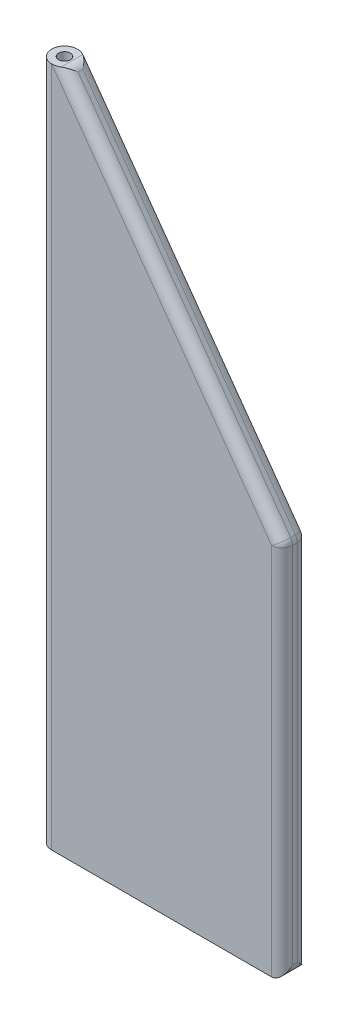
from build123d import *

# Parameters (mm, degrees)
SKETCH1_R                       = 1.225
SKETCH1_R_2                     = 0.56
BOSS_EXTRUDE1_DEPTH             = 65
BOSS_EXTRUDE2_DEPTH             = 36
BOSS_EXTRUDE3_REACH             = 70.633
BOSS_EXTRUDE3_DIRECTION_2_REACH = 70.633
CUT_EXTRUDE1_DEPTH              = 69.633086955
CUT_EXTRUDE1_DEPTH_BACK         = 69.633086955
SKETCH3_R                       = 0.56
FILLET2_R                       = 1


with BuildPart() as part:
    # Sketch1 → Boss-Extrude1 (new body)
    with BuildSketch(Plane(origin=(0, 0, 0), x_dir=(1, 0, 0), z_dir=(0, 1, 0))):
        with Locations(Location((0, 0, 0), (0, 0, 270))):
            Circle(SKETCH1_R)
        with Locations(Location((0, 0, 0), (0, 0, 270))):
            Circle(SKETCH1_R_2, mode=Mode.SUBTRACT)
    extrude(amount=BOSS_EXTRUDE1_DEPTH)

    # Sketch1<4> → Boss-Extrude2 (add)
    with BuildSketch(Plane(origin=(0, 0, 0), x_dir=(1, 0, 0), z_dir=(0, 1, 0))):
        with BuildLine():
            Line((22, 1.225), (0, 1.225))
            ThreePointArc((0, 1.225), (0.866205807, 0.866205807), (1.225, 0))
            ThreePointArc((1.225, 0), (0.866205807, -0.866205807), (0, -1.225))
            Line((0, -1.225), (22, -1.225))
            Line((22, -1.225), (22, 1.225))
        make_face()
    extrude(amount=BOSS_EXTRUDE2_DEPTH)

    # Boss-Extrude3: up to this face of the body (flat: up to its plane)
    boss_extrude3_end = Plane(part.part.faces().sort_by_distance((11, 18, 1.225))[0])
    # Sketch2 → Boss-Extrude3 (add, up to the picked face)
    with BuildSketch(Plane.XY, mode=Mode.PRIVATE) as boss_extrude3_sk1:
        Polygon((1.225, 65), (22, 36), (0, 36), (0, 65), align=None)
    boss_extrude3_tool1 = split(extrude(boss_extrude3_sk1.sketch, amount=BOSS_EXTRUDE3_REACH, mode=Mode.PRIVATE), bisect_by=boss_extrude3_end, keep=Keep.BOTH, mode=Mode.PRIVATE)
    add(boss_extrude3_tool1.solids().sort_by(Axis((7.354871, 46.176534, 0), (0, 0, 1)))[0])

    # Boss-Extrude3 direction 2: up to this face of the body (flat: up to its plane)
    boss_extrude3_direction_2_end = Plane(part.part.faces().sort_by_distance((11, 18, -1.225))[0])
    # Sketch2 → Boss-Extrude3 direction 2 (add, up to the picked face)
    with BuildSketch(Plane.XY, mode=Mode.PRIVATE) as boss_extrude3_direction_2_sk1:
        Polygon((1.225, 65), (22, 36), (0, 36), (0, 65), align=None)
    boss_extrude3_direction_2_tool1 = split(extrude(boss_extrude3_direction_2_sk1.sketch, amount=-BOSS_EXTRUDE3_DIRECTION_2_REACH, mode=Mode.PRIVATE), bisect_by=boss_extrude3_direction_2_end, keep=Keep.BOTH, mode=Mode.PRIVATE)
    add(boss_extrude3_direction_2_tool1.solids().sort_by(Axis((7.354871, 46.176534, 0), (0, 0, -1)))[0])

    # Sketch3 → Cut-Extrude1 (cut, two sides: drawn at the far end of the back side and taken through both)
    with BuildSketch(Plane(origin=(0, 0, 0), x_dir=(1, 0, 0), z_dir=(0, 1, 0)).offset(-CUT_EXTRUDE1_DEPTH_BACK)):
        with Locations(Location((0, 0, 0), (0, 0, 270))):
            Circle(SKETCH3_R)
    extrude(amount=CUT_EXTRUDE1_DEPTH + CUT_EXTRUDE1_DEPTH_BACK, mode=Mode.SUBTRACT)

    # Fillet2
    # the kernel refuses this fillet: 1 mm, written as the material it takes off along each edge
    with BuildSketch(Plane(origin=(21, 35.678771199, 0.225), x_dir=(0.8129277181323856, 0.5823645980758727, 0), z_dir=(0, 0, 1))) as fillet2_piece_1_section:
        Polygon((0, 0), (FILLET2_R * 1.02, 0), (FILLET2_R * 1.02, -FILLET2_R * 0.327653377515), (FILLET2_R * 0.829186272495, -FILLET2_R * 0.594011890037), align=None)
    fillet2_piece_1 = extrude(amount=FILLET2_R * 1.02, mode=Mode.PRIVATE)
    fillet2_piece_1 = fillet2_piece_1 - Plane(origin=(21, 35.678771199, 0.225), x_dir=(-0.9520839558915971, -0.3058367880648226, 0), z_dir=(0, 0, 1)) * Sphere(FILLET2_R, mode=Mode.PRIVATE)
    add(fillet2_piece_1, mode=Mode.SUBTRACT)
    with BuildSketch(Plane(origin=(21, 35.678771199, -0.225), x_dir=(0.8129277181323856, 0.5823645980758727, 0), z_dir=(0, 0, -1))) as fillet2_piece_2_section:
        Polygon((0, 0), (FILLET2_R * 1.02, 0), (FILLET2_R * 1.02, FILLET2_R * 0.327653377515), (FILLET2_R * 0.829186272495, FILLET2_R * 0.594011890037), align=None)
    fillet2_piece_2 = extrude(amount=FILLET2_R * 1.02, mode=Mode.PRIVATE)
    fillet2_piece_2 = fillet2_piece_2 - Plane(origin=(21, 35.678771199, -0.225), x_dir=(-0.9520839558915971, -0.3058367880648226, 0), z_dir=(0, 0, -1)) * Sphere(FILLET2_R, mode=Mode.PRIVATE)
    add(fillet2_piece_2, mode=Mode.SUBTRACT)
    with BuildSketch(Plane(origin=(22, -2.5, 1.225), x_dir=(0, 0, -1), z_dir=(0, 1, 0))) as fillet2_piece_3:
        with BuildLine():
            CenterArc((FILLET2_R, FILLET2_R), FILLET2_R, 180, 90)
            Line((0, FILLET2_R), (0, 0))
            Line((0, 0), (FILLET2_R, 0))
        make_face()
    extrude(amount=38.178771199, mode=Mode.SUBTRACT)
    with BuildSketch(Plane(origin=(22, -2.5, -1.225), x_dir=(0, 0, 1), z_dir=(0, 1, 0))) as fillet2_piece_4:
        with BuildLine():
            CenterArc((FILLET2_R, -FILLET2_R), FILLET2_R, 90, 90)
            Line((0, -FILLET2_R), (0, 0))
            Line((0, 0), (FILLET2_R, 0))
        make_face()
    extrude(amount=38.178771199, mode=Mode.SUBTRACT)
    with BuildSketch(Plane(origin=(22, 0, 3.725), x_dir=(0, 1, 0), z_dir=(0, 0, -1))) as fillet2_piece_5:
        with BuildLine():
            CenterArc((FILLET2_R, -FILLET2_R), FILLET2_R, 90, 90)
            Line((0, -FILLET2_R), (0, 0))
            Line((0, 0), (FILLET2_R, 0))
        make_face()
    extrude(amount=7.45, mode=Mode.SUBTRACT)
    with BuildSketch(Plane(origin=(1.225, 65, 2.509355892), x_dir=(-1, 0, 0), z_dir=(0, 0, -1))) as fillet2_piece_6:
        with BuildLine():
            CenterArc((FILLET2_R * 0.513742356926, -FILLET2_R), FILLET2_R, 90, 54.382971688)
            Line((-FILLET2_R * 0.299185361206, -FILLET2_R * 0.417635401924), (0, 0))
            Line((0, 0), (FILLET2_R * 0.513742356926, 0))
        make_face()
    extrude(amount=5.018711785, mode=Mode.SUBTRACT)
    with BuildSketch(Plane(origin=(-0.230911495, 67.032319295, 1.225), x_dir=(0, 0, -1), z_dir=(0.5823645980758727, -0.8129277181323856, 0))) as fillet2_piece_7_section:
        with BuildLine():
            CenterArc((FILLET2_R, -FILLET2_R), FILLET2_R, 90, 90)
            Line((0, -FILLET2_R), (0, 0))
            Line((0, 0), (FILLET2_R, 0))
        make_face()
    fillet2_piece_7 = extrude(amount=37.852299549, mode=Mode.PRIVATE)
    fillet2_piece_7 = fillet2_piece_7 - Plane(origin=(0, 50.565320585, 0), x_dir=(0, 0, 1), z_dir=(0, -1, 0)) * Cylinder(1.225, 80, mode=Mode.PRIVATE)
    add(fillet2_piece_7, mode=Mode.SUBTRACT)
    with BuildSketch(Plane(origin=(-0.230911495, 67.032319295, -1.225), x_dir=(0, 0, 1), z_dir=(0.5823645980758727, -0.8129277181323856, 0))) as fillet2_piece_8_section:
        with BuildLine():
            CenterArc((FILLET2_R, FILLET2_R), FILLET2_R, 180, 90)
            Line((0, FILLET2_R), (0, 0))
            Line((0, 0), (FILLET2_R, 0))
        make_face()
    fillet2_piece_8 = extrude(amount=37.852299549, mode=Mode.PRIVATE)
    fillet2_piece_8 = fillet2_piece_8 - Plane(origin=(0, 50.565320569, 0), x_dir=(0, 0, 1), z_dir=(0, -1, 0)) * Cylinder(1.225, 80, mode=Mode.PRIVATE)
    add(fillet2_piece_8, mode=Mode.SUBTRACT)
    with BuildSketch(Plane(origin=(22, 36, 0.225), x_dir=(-0.582364598075886, 0.812927718132376, 0), z_dir=(0, 0, -1))) as fillet2_piece_9:
        with BuildLine():
            CenterArc((FILLET2_R * 0.321228801486, -FILLET2_R), FILLET2_R, 90, 35.617028312)
            Line((-FILLET2_R * 0.26113579659, -FILLET2_R * 0.187072281868), (0, 0))
            Line((0, 0), (FILLET2_R * 0.321228801486, 0))
        make_face()
    extrude(amount=0.45, mode=Mode.SUBTRACT)


solid = part.part
